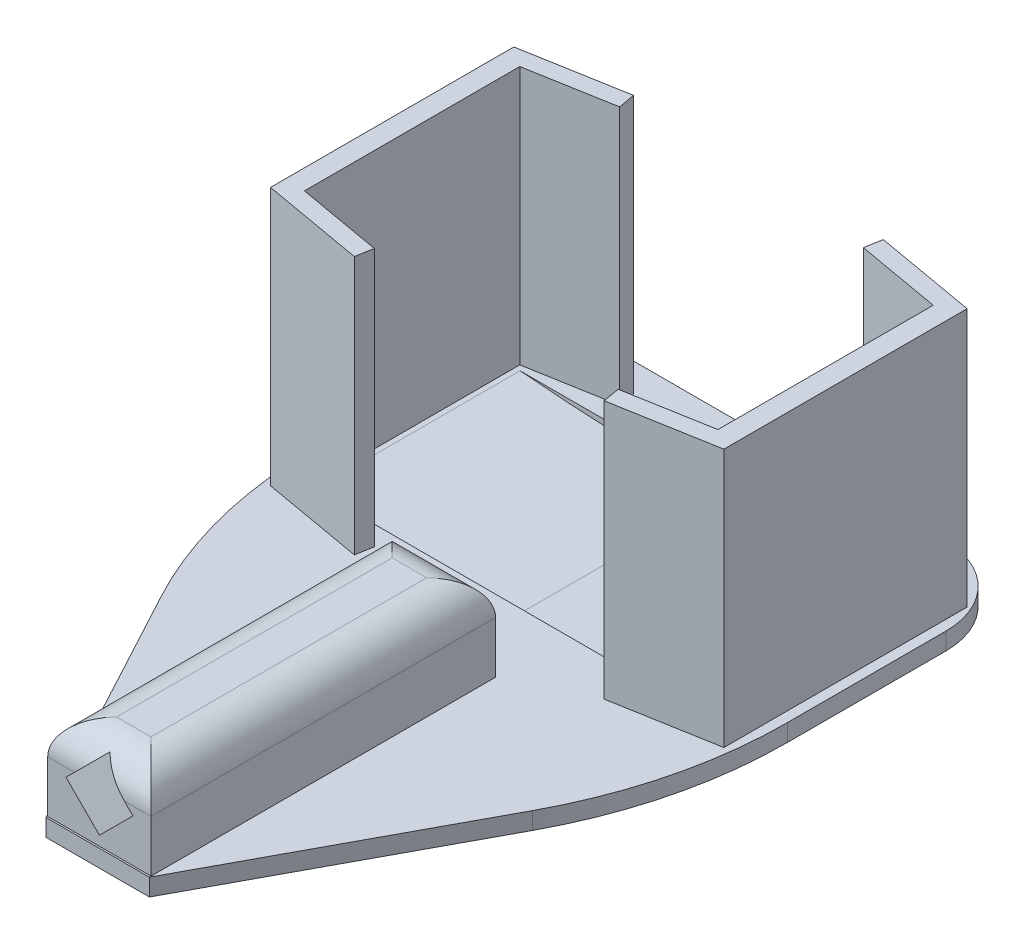
from build123d import *

# Parameters (mm, degrees)
BOSS_EXTRUDE1_DEPTH = 2
BOSS_EXTRUDE2_DEPTH = 30
SKETCH3_W           = 12
SKETCH3_H           = 40
BOSS_EXTRUDE3_DEPTH = 10
CUT_EXTRUDE1_DEPTH  = 35
SKETCH6_W           = 46.796643592
SKETCH6_H           = 23.882016553
CUT_EXTRUDE2_DEPTH  = 1
FILLET1_R           = 280
FILLET2_R           = 9
FILLET3_R           = 4
FILLET4_R           = 50


with BuildPart() as part:
    # Sketch1 → Boss-Extrude1 (new body)
    with BuildSketch(Plane(origin=(0, 0, 0), x_dir=(1, 0, 0), z_dir=(0, 1, 0))):
        Polygon((-27.5, 1.096246938), (-6, -38.903753062), (6, -38.903753062), (27.5, 1.096246938), (27.5, 41.096246938), (-27.5, 41.096246938), align=None)
    extrude(amount=BOSS_EXTRUDE1_DEPTH)

    # Sketch2 → Boss-Extrude2 (add)
    with BuildSketch(Plane(origin=(0, 2, 0), x_dir=(1, 0, 0), z_dir=(0, 1, 0))):
        Polygon((-24, 9.101662984), (-24, 34.101662984), (-14.15192247, 35.838144761), (-14.499218825, 37.807760267), (-26.316911861, 35.723982135), (-26.316911861, 7.479343833), (-14.499218825, 5.395565701), (-14.15192247, 7.365181207), align=None)
        Polygon((14.15192247, 7.365181207), (14.499218825, 5.395565701), (26.316911861, 7.479343833), (26.316911861, 35.723982135), (14.499218825, 37.807760267), (14.15192247, 35.838144761), (24, 34.101662984), (24, 9.101662984), align=None)
    extrude(amount=BOSS_EXTRUDE2_DEPTH)

    # Sketch3 → Boss-Extrude3 (add)
    with BuildSketch(Plane(origin=(0, 2, 0), x_dir=(1, 0, 0), z_dir=(0, 1, 0))):
        with Locations((-0.005517933, -18.7)):
            Rectangle(SKETCH3_W, SKETCH3_H)
    extrude(amount=BOSS_EXTRUDE3_DEPTH)

    # Sketch4 → Cut-Extrude1 (cut)
    with BuildSketch(Plane.XY.offset(38.7)):
        Polygon((0, 3.110912703), (3.889087297, 7), (0, 10.889087297), (-3.889087297, 7), align=None)
    extrude(amount=-CUT_EXTRUDE1_DEPTH, mode=Mode.SUBTRACT)

    # Sketch6 → Cut-Extrude2 (cut)
    with BuildSketch(Plane(origin=(0, 2, 0), x_dir=(1, 0, 0), z_dir=(0, 1, 0))):
        with Locations((0, 21.585626422)):
            Rectangle(SKETCH6_W, SKETCH6_H)
    extrude(amount=-CUT_EXTRUDE2_DEPTH, mode=Mode.SUBTRACT)

    # Fillet1
    # the kernel refuses this fillet: 280 mm, written as the material it adds along each edge
    with BuildSketch(Plane(origin=(23.398321796, 1, -92.634586786), x_dir=(0, 1, 0), z_dir=(0, 0, 1))) as fillet1_piece_1_section:
        with BuildLine():
            CenterArc((280, 23.643180835), FILLET1_R, 180, 4.843819526)
            Line((0, 23.643180835), (0, 0))
            Line((0, 0), (1, 0))
        make_face()
    fillet1_piece_1 = extrude(amount=142.097920729, mode=Mode.PRIVATE)
    fillet1_piece_1 = split(fillet1_piece_1, bisect_by=Plane(origin=(14.446064127, 1.194161729, -5.386193094), z_dir=(-0.1736481776669284, 0, -0.9848077530122085)), keep=Keep.TOP, mode=Mode.PRIVATE)
    fillet1_piece_1 = split(fillet1_piece_1, bisect_by=Plane(origin=(14.451548954, 1.194161729, -37.816165751), z_dir=(-0.17364817766692828, 0, 0.9848077530122085)), keep=Keep.TOP, mode=Mode.PRIVATE)
    add(fillet1_piece_1)
    with BuildSketch(Plane(origin=(-23.398321796, 1, -9.644618145), x_dir=(0, 1, 0), z_dir=(0, 0, -1))) as fillet1_piece_2:
        with BuildLine():
            CenterArc((280, 23.643180835), FILLET1_R, 180, 4.843819526)
            Line((0, 23.643180835), (0, 0))
            Line((0, 0), (1, 0))
        make_face()
    extrude(amount=23.882016554)

    # Fillet2
    fillet2_edges = [part.edges().sort_by_distance(p)[0] for p in [
        (-27.5, 1, -41.096246938),
        (27.5, 1, -41.096246938),
    ]]
    fillet(fillet2_edges, radius=FILLET2_R)

    # Fillet3
    # the kernel refuses this fillet: 4 mm, written as the material it takes off along each edge
    with BuildSketch(Plane(origin=(5.994482067, 12, 48.7), x_dir=(0, -1, 0), z_dir=(0, 0, -1)), Plane(origin=(-6.005517933, 12, -11.3), x_dir=(0, -1, 0), z_dir=(0, 0, 1))) as fillet3_piece_1:
        with BuildLine():
            CenterArc((FILLET3_R, FILLET3_R), FILLET3_R, 180, 90)
            Line((0, FILLET3_R), (0, 0))
            Line((0, 0), (FILLET3_R, 0))
        make_face()
    extrude(amount=60, mode=Mode.SUBTRACT)
    with BuildSketch(Plane(origin=(15.994482067, 12, -1.3), x_dir=(0, -1, 0), z_dir=(-1, 0, 0)), Plane(origin=(-16.005517933, 12, 38.7), x_dir=(0, -1, 0), z_dir=(1, 0, 0))) as fillet3_piece_2:
        with BuildLine():
            CenterArc((FILLET3_R, FILLET3_R), FILLET3_R, 180, 90)
            Line((0, FILLET3_R), (0, 0))
            Line((0, 0), (FILLET3_R, 0))
        make_face()
    extrude(amount=32, mode=Mode.SUBTRACT)

    # Fillet4
    fillet4_edges = [part.edges().sort_by_distance(p)[0] for p in [
        (-27.5, 1, -1.096246938),
        (27.5, 1, -1.096246938),
    ]]
    fillet(fillet4_edges, radius=FILLET4_R)


solid = part.part
